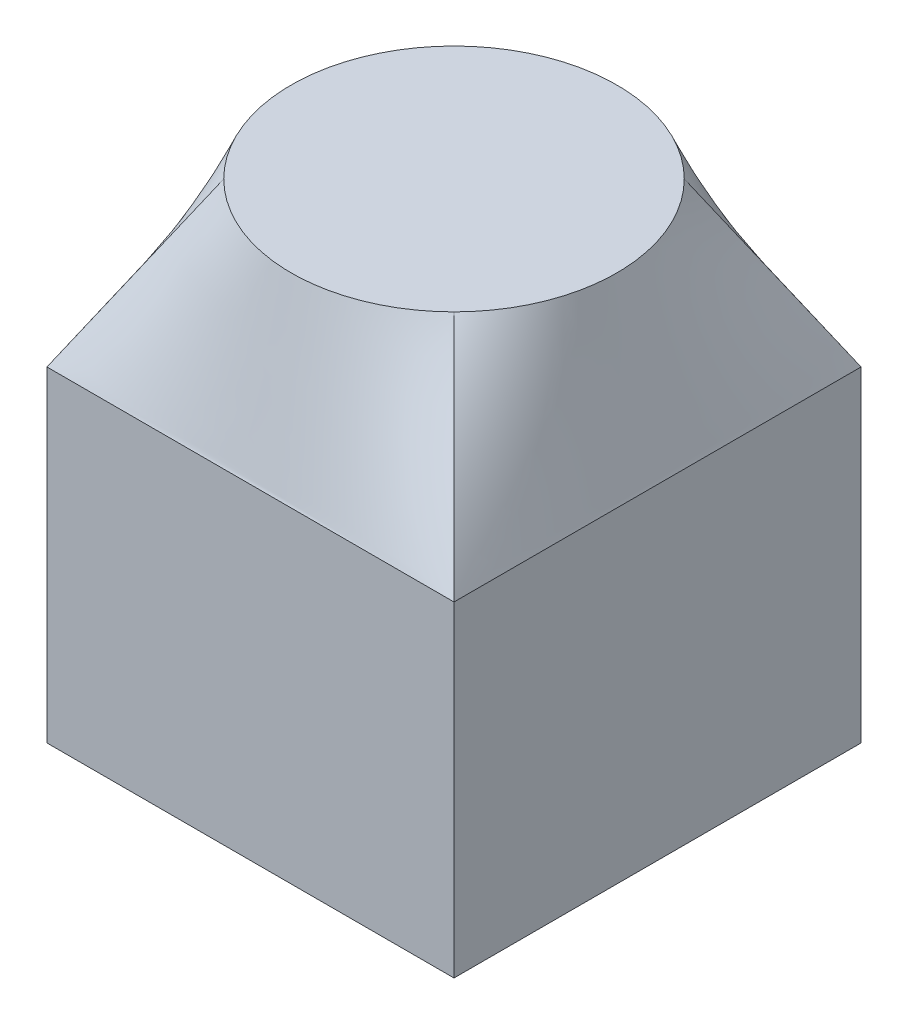
from build123d import *

# Parameters (mm, degrees)
SKETCH2_W           = 25
SKETCH2_H           = 25
BOSS_EXTRUDE1_DEPTH = 20
SKETCH3_W           = 18.8
SKETCH3_H           = 18.8
CUT_EXTRUDE1_DEPTH  = 18.8


with BuildPart() as part:
    # Sketch2 → Boss-Extrude1 (new body)
    with BuildSketch(Plane(origin=(0, 0, 0), x_dir=(1, 0, 0), z_dir=(0, 1, 0))):
        Rectangle(SKETCH2_W, SKETCH2_H)
    extrude(amount=BOSS_EXTRUDE1_DEPTH)

    # Sketch3 → Cut-Extrude1 (cut)
    with BuildSketch(Plane.XZ):
        Rectangle(SKETCH3_W, SKETCH3_H)
    extrude(amount=-CUT_EXTRUDE1_DEPTH, mode=Mode.SUBTRACT)

    # Loft1: read off the stored shape, not the designer's step
    # Loft1: loft between two sections, ruled curve by curve
    loft1_from = [
        Edge.make_bspline([(-12.5, 20, 12.5), (-11.458333333, 20, 12.5), (-10.416666667, 20, 12.5), (-8.333333333, 20, 12.5), (-7.291666667, 20, 12.5), (-5.208333333, 20, 12.5), (-4.166666667, 20, 12.5), (-2.083333333, 20, 12.5), (-1.041666667, 20, 12.5), (1.041666667, 20, 12.5), (2.083333333, 20, 12.5), (4.166666667, 20, 12.5), (5.208333333, 20, 12.5), (7.291666667, 20, 12.5), (8.333333333, 20, 12.5), (10.416666667, 20, 12.5), (11.458333333, 20, 12.5), (12.5, 20, 12.5)], [0, 0, 0, 0, 0.125, 0.125, 0.25, 0.25, 0.375, 0.375, 0.5, 0.5, 0.625, 0.625, 0.75, 0.75, 0.875, 0.875, 1, 1, 1, 1], 3),
        Edge.make_bspline([(12.5, 20, 12.5), (12.5, 20, 11.458333333), (12.5, 20, 10.416666667), (12.5, 20, 8.333333333), (12.5, 20, 7.291666667), (12.5, 20, 5.208333333), (12.5, 20, 4.166666667), (12.5, 20, 2.083333333), (12.5, 20, 1.041666667), (12.5, 20, -1.041666667), (12.5, 20, -2.083333333), (12.5, 20, -4.166666667), (12.5, 20, -5.208333333), (12.5, 20, -7.291666667), (12.5, 20, -8.333333333), (12.5, 20, -10.416666667), (12.5, 20, -11.458333333), (12.5, 20, -12.5)], [0, 0, 0, 0, 0.125, 0.125, 0.25, 0.25, 0.375, 0.375, 0.5, 0.5, 0.625, 0.625, 0.75, 0.75, 0.875, 0.875, 1, 1, 1, 1], 3),
        Edge.make_bspline([(-12.5, 20, -12.5), (-12.5, 20, -11.458333333), (-12.5, 20, -10.416666667), (-12.5, 20, -8.333333333), (-12.5, 20, -7.291666667), (-12.5, 20, -5.208333333), (-12.5, 20, -4.166666667), (-12.5, 20, -2.083333333), (-12.5, 20, -1.041666667), (-12.5, 20, 1.041666667), (-12.5, 20, 2.083333333), (-12.5, 20, 4.166666667), (-12.5, 20, 5.208333333), (-12.5, 20, 7.291666667), (-12.5, 20, 8.333333333), (-12.5, 20, 10.416666667), (-12.5, 20, 11.458333333), (-12.5, 20, 12.5)], [0, 0, 0, 0, 0.125, 0.125, 0.25, 0.25, 0.375, 0.375, 0.5, 0.5, 0.625, 0.625, 0.75, 0.75, 0.875, 0.875, 1, 1, 1, 1], 3),
        Edge.make_bspline([(12.5, 20, -12.5), (11.458333333, 20, -12.5), (10.416666667, 20, -12.5), (8.333333333, 20, -12.5), (7.291666667, 20, -12.5), (5.208333333, 20, -12.5), (4.166666667, 20, -12.5), (2.083333333, 20, -12.5), (1.041666667, 20, -12.5), (-1.041666667, 20, -12.5), (-2.083333333, 20, -12.5), (-4.166666667, 20, -12.5), (-5.208333333, 20, -12.5), (-7.291666667, 20, -12.5), (-8.333333333, 20, -12.5), (-10.416666667, 20, -12.5), (-11.458333333, 20, -12.5), (-12.5, 20, -12.5)], [0, 0, 0, 0, 0.125, 0.125, 0.25, 0.25, 0.375, 0.375, 0.5, 0.5, 0.625, 0.625, 0.75, 0.75, 0.875, 0.875, 1, 1, 1, 1], 3),
    ]
    loft1_to = [
        Edge.make_bspline([(-7.071067812, 30, 7.071067812), (-6.654401145, 30, 7.487734479), (-6.18511191, 30, 7.882942296), (-5.147579804, 30, 8.596441749), (-4.57928395, 30, 8.914502371), (-3.364263, 30, 9.440335189), (-2.717633031, 30, 9.647849649), (-1.380556459, 30, 9.927768934), (-0.690355937, 30, 10), (0.690355937, 30, 10), (1.380556459, 30, 9.927768934), (2.717633031, 30, 9.647849649), (3.364263, 30, 9.440335189), (4.57928395, 30, 8.914502371), (5.147579804, 30, 8.596441749), (6.18511191, 30, 7.882942296), (6.654401145, 30, 7.487734479), (7.071067812, 30, 7.071067812)], [0, 0, 0, 0, 0.125, 0.125, 0.25, 0.25, 0.375, 0.375, 0.5, 0.5, 0.625, 0.625, 0.75, 0.75, 0.875, 0.875, 1, 1, 1, 1], 3),
        Edge.make_bspline([(7.071067812, 30, 7.071067812), (7.487734479, 30, 6.654401145), (7.882942296, 30, 6.18511191), (8.596441749, 30, 5.147579804), (8.914502371, 30, 4.57928395), (9.440335189, 30, 3.364263), (9.647849649, 30, 2.717633031), (9.927768934, 30, 1.380556459), (10, 30, 0.690355937), (10, 30, -0.690355937), (9.927768934, 30, -1.380556459), (9.647849649, 30, -2.717633031), (9.440335189, 30, -3.364263), (8.914502371, 30, -4.57928395), (8.596441749, 30, -5.147579804), (7.882942296, 30, -6.18511191), (7.487734479, 30, -6.654401145), (7.071067812, 30, -7.071067812)], [0, 0, 0, 0, 0.125, 0.125, 0.25, 0.25, 0.375, 0.375, 0.5, 0.5, 0.625, 0.625, 0.75, 0.75, 0.875, 0.875, 1, 1, 1, 1], 3),
        Edge.make_bspline([(-7.071067812, 30, -7.071067812), (-7.487734479, 30, -6.654401145), (-7.882942296, 30, -6.18511191), (-8.596441749, 30, -5.147579804), (-8.914502371, 30, -4.57928395), (-9.440335189, 30, -3.364263), (-9.647849649, 30, -2.717633031), (-9.927768934, 30, -1.380556459), (-10, 30, -0.690355937), (-10, 30, 0.690355937), (-9.927768934, 30, 1.380556459), (-9.647849649, 30, 2.717633031), (-9.440335189, 30, 3.364263), (-8.914502371, 30, 4.57928395), (-8.596441749, 30, 5.147579804), (-7.882942296, 30, 6.18511191), (-7.487734479, 30, 6.654401145), (-7.071067812, 30, 7.071067812)], [0, 0, 0, 0, 0.125, 0.125, 0.25, 0.25, 0.375, 0.375, 0.5, 0.5, 0.625, 0.625, 0.75, 0.75, 0.875, 0.875, 1, 1, 1, 1], 3),
        Edge.make_bspline([(7.071067812, 30, -7.071067812), (6.654401145, 30, -7.487734479), (6.18511191, 30, -7.882942296), (5.147579804, 30, -8.596441749), (4.57928395, 30, -8.914502371), (3.364263, 30, -9.440335189), (2.717633031, 30, -9.647849649), (1.380556459, 30, -9.927768934), (0.690355937, 30, -10), (-0.690355937, 30, -10), (-1.380556459, 30, -9.927768934), (-2.717633031, 30, -9.647849649), (-3.364263, 30, -9.440335189), (-4.57928395, 30, -8.914502371), (-5.147579804, 30, -8.596441749), (-6.18511191, 30, -7.882942296), (-6.654401145, 30, -7.487734479), (-7.071067812, 30, -7.071067812)], [0, 0, 0, 0, 0.125, 0.125, 0.25, 0.25, 0.375, 0.375, 0.5, 0.5, 0.625, 0.625, 0.75, 0.75, 0.875, 0.875, 1, 1, 1, 1], 3),
    ]
    loft1 = Solid(Shell([*[Face.make_surface_from_curves(loft1_from[k], loft1_to[k]) for k in range(4)], Face(Wire(loft1_from)), Face(Wire(loft1_to))]))
    add(loft1)


solid = part.part
